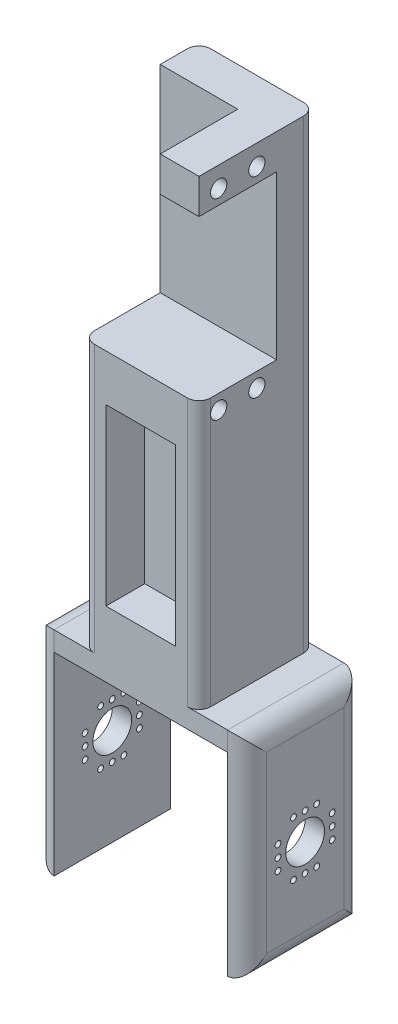
from build123d import *

# Parameters (mm, degrees)
SKETCH_1_W          = 44.75
SKETCH_1_H          = 50
EXTRUDE_1_DEPTH     = 30
SHELL_1_T           = 5
FILLET_1_R          = 5
SKETCH_2_R          = 0.75
CUT_EXTRUDE_1_DEPTH = 70.264438928
SKETCH_3_R          = 5
CUT_EXTRUDE_2_DEPTH = 70.264438928
EXTRUDE_2_DEPTH     = 30
CUT_EXTRUDE_3_DEPTH = 20
SKETCH_7_R          = 2.1
CUT_EXTRUDE_4_DEPTH = 159.731347329
SKETCH_8_W          = 18
SKETCH_8_H          = 45
CUT_EXTRUDE_5_DEPTH = 10
SKETCH_9_W          = 18
SKETCH_9_H          = 45
CUT_EXTRUDE_6_DEPTH = 10
FILLET_2_R          = 3


with BuildPart() as part:
    # 草图1 → 凸台-拉伸1 (new body)
    with BuildSketch(Plane.XY):
        Rectangle(SKETCH_1_W, SKETCH_1_H)
    extrude(amount=EXTRUDE_1_DEPTH)

    # 抽壳1
    shell_1_openings = [part.faces().sort_by_distance(p)[0] for p in [
        (0, -25, 15),
        (0, 0, 0),
        (0, 0, 30),
    ]]
    offset(amount=SHELL_1_T, openings=shell_1_openings, kind=Kind.INTERSECTION)

    # 圆角1
    # the kernel refuses this fillet: 5 mm, written as the material it takes off along each edge
    with BuildSketch(Plane(origin=(-27.375, 30, -12.5), x_dir=(1, 0, 0), z_dir=(0, 0, 1)), Plane(origin=(-27.375, -25, 42.5), x_dir=(1, 0, 0), z_dir=(0, 0, -1)), Plane(origin=(27.375, -25, -12.5), x_dir=(-1, 0, 0), z_dir=(0, 0, 1)), Plane(origin=(27.375, 30, 42.5), x_dir=(-1, 0, 0), z_dir=(0, 0, -1))) as fillet_1_piece_1:
        with BuildLine():
            CenterArc((FILLET_1_R, -FILLET_1_R), FILLET_1_R, 90, 90)
            Line((0, -FILLET_1_R), (0, 0))
            Line((0, 0), (FILLET_1_R, 0))
        make_face()
    extrude(amount=55, mode=Mode.SUBTRACT)
    with BuildSketch(Plane(origin=(-27.375, -37.5, 30), x_dir=(1, 0, 0), z_dir=(0, 1, 0)), Plane(origin=(27.375, 42.5, 30), x_dir=(-1, 0, 0), z_dir=(0, -1, 0))) as fillet_1_piece_2:
        with BuildLine():
            CenterArc((FILLET_1_R, FILLET_1_R), FILLET_1_R, 180, 90)
            Line((0, FILLET_1_R), (0, 0))
            Line((0, 0), (FILLET_1_R, 0))
        make_face()
    extrude(amount=80, mode=Mode.SUBTRACT)
    with BuildSketch(Plane(origin=(-27.375, -37.5, 0), x_dir=(1, 0, 0), z_dir=(0, 1, 0)), Plane(origin=(27.375, 42.5, 0), x_dir=(-1, 0, 0), z_dir=(0, -1, 0))) as fillet_1_piece_3:
        with BuildLine():
            CenterArc((FILLET_1_R, -FILLET_1_R), FILLET_1_R, 90, 90)
            Line((0, -FILLET_1_R), (0, 0))
            Line((0, 0), (FILLET_1_R, 0))
        make_face()
    extrude(amount=80, mode=Mode.SUBTRACT)

    # 草图2 → 切除-拉伸1 (cut, through all)
    with BuildSketch(Plane.ZY.offset(27.375)):
        with Locations(Location((15, 7, 0), (0, 0, 270))):
            Circle(SKETCH_2_R)
        with Locations(Location((12, 7, 0), (0, 0, 270))):
            Circle(SKETCH_2_R)
        with Locations(Location((18, 7, 0), (0, 0, 270))):
            Circle(SKETCH_2_R)
        with Locations(Location((8, -3, 0), (0, 0, 90))):
            Circle(SKETCH_2_R)
        with Locations(Location((8, 0, 0), (0, 0, 90))):
            Circle(SKETCH_2_R)
        with Locations(Location((8, 3, 0), (0, 0, 90))):
            Circle(SKETCH_2_R)
        with Locations(Location((12, -7, 0), (0, 0, 90))):
            Circle(SKETCH_2_R)
        with Locations(Location((15, -7, 0), (0, 0, 90))):
            Circle(SKETCH_2_R)
        with Locations(Location((18, -7, 0), (0, 0, 90))):
            Circle(SKETCH_2_R)
        with Locations(Location((22, -3, 0), (0, 0, 270))):
            Circle(SKETCH_2_R)
        with Locations(Location((22, 0, 0), (0, 0, 270))):
            Circle(SKETCH_2_R)
        with Locations(Location((22, 3, 0), (0, 0, 270))):
            Circle(SKETCH_2_R)
    extrude(amount=-CUT_EXTRUDE_1_DEPTH, mode=Mode.SUBTRACT)

    # 草图3 → 切除-拉伸2 (cut, through all)
    with BuildSketch(Plane(origin=(27.375, 0, 0), x_dir=(0, 0, -1), z_dir=(1, 0, 0))):
        with Locations(Location((-15, 0, 0), (0, 0, 90))):
            Circle(SKETCH_3_R)
    extrude(amount=-CUT_EXTRUDE_2_DEPTH, mode=Mode.SUBTRACT)

    # 草图4 → 凸台-拉伸2 (add)
    with BuildSketch(Plane.XY.offset(30)):
        Polygon((0, 30), (-15, 30), (-15, 150), (15, 150), (15, 30), align=None)
    extrude(amount=-EXTRUDE_2_DEPTH)

    # 草图6 → 切除-拉伸3 (cut)
    with BuildSketch(Plane.XY.offset(30)):
        Polygon((-15, 99), (15, 99), (15, 141), (5, 141), (5, 150), (-15, 150), (-15, 141), align=None)
    extrude(amount=-CUT_EXTRUDE_3_DEPTH, mode=Mode.SUBTRACT)

    # 草图7 → 切除-拉伸4 (cut, through all)
    with BuildSketch(Plane(origin=(15, 0, 0), x_dir=(0, 0, -1), z_dir=(1, 0, 0))):
        with Locations((-24.925, 144.75)):
            Circle(SKETCH_7_R)
        with Locations((-15.075, 144.75)):
            Circle(SKETCH_7_R)
        with Locations(Location((-15.075, 95.25, 0), (0, 0, 180))):
            Circle(SKETCH_7_R)
        with Locations(Location((-24.925, 95.25, 0), (0, 0, 180))):
            Circle(SKETCH_7_R)
    extrude(amount=-CUT_EXTRUDE_4_DEPTH, mode=Mode.SUBTRACT)

    # 草图8 → 切除-拉伸5 (cut)
    with BuildSketch(Plane.XY.offset(30)):
        with Locations((0, 64.5)):
            Rectangle(SKETCH_8_W, SKETCH_8_H)
    extrude(amount=-CUT_EXTRUDE_5_DEPTH, mode=Mode.SUBTRACT)

    # 草图9 → 切除-拉伸6 (cut)
    with BuildSketch(Plane(origin=(0, 0, 0), x_dir=(-1, 0, 0), z_dir=(0, 0, -1))):
        with Locations((0, 65)):
            Rectangle(SKETCH_9_W, SKETCH_9_H)
    extrude(amount=-CUT_EXTRUDE_6_DEPTH, mode=Mode.SUBTRACT)

    # 圆角2
    fillet_2_edges = [part.edges().sort_by_distance(p)[0] for p in [
        (-15, 90, 0),
        (15, 90, 0),
        (15, 64.5, 30),
        (-15, 64.5, 30),
    ]]
    fillet(fillet_2_edges, radius=FILLET_2_R)


solid = part.part
